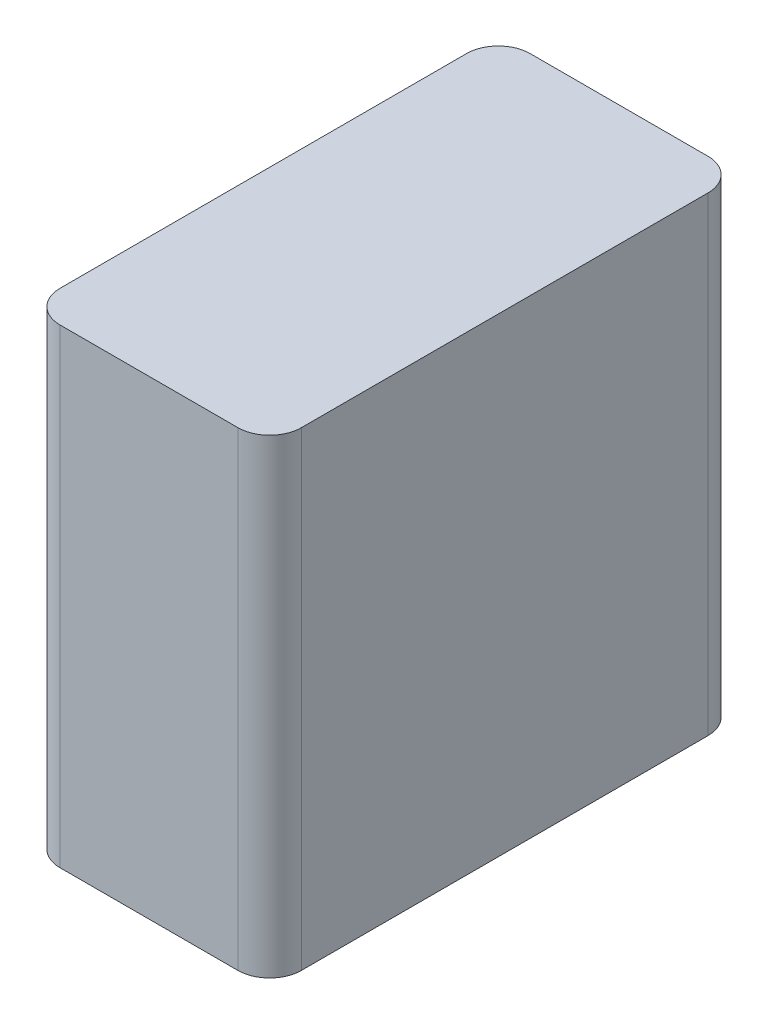
from build123d import *

# Parameters (mm, degrees)
SKETCH1_W           = 74
SKETCH1_H           = 74
BOSS_EXTRUDE1_DEPTH = 38
FILLET1_R           = 5


with BuildPart() as part:
    # Sketch1 → Boss-Extrude1 (new body)
    with BuildSketch(Plane(origin=(0, 0, 0), x_dir=(0, 0, -1), z_dir=(1, 0, 0))):
        with Locations((37, 37)):
            Rectangle(SKETCH1_W, SKETCH1_H)
    extrude(amount=BOSS_EXTRUDE1_DEPTH)

    # Fillet1
    fillet1_edges = [part.edges().sort_by_distance(p)[0] for p in [
        (0, 37, 0),
        (38, 37, 0),
        (38, 37, -74),
        (0, 37, -74),
    ]]
    fillet(fillet1_edges, radius=FILLET1_R)


solid = part.part
